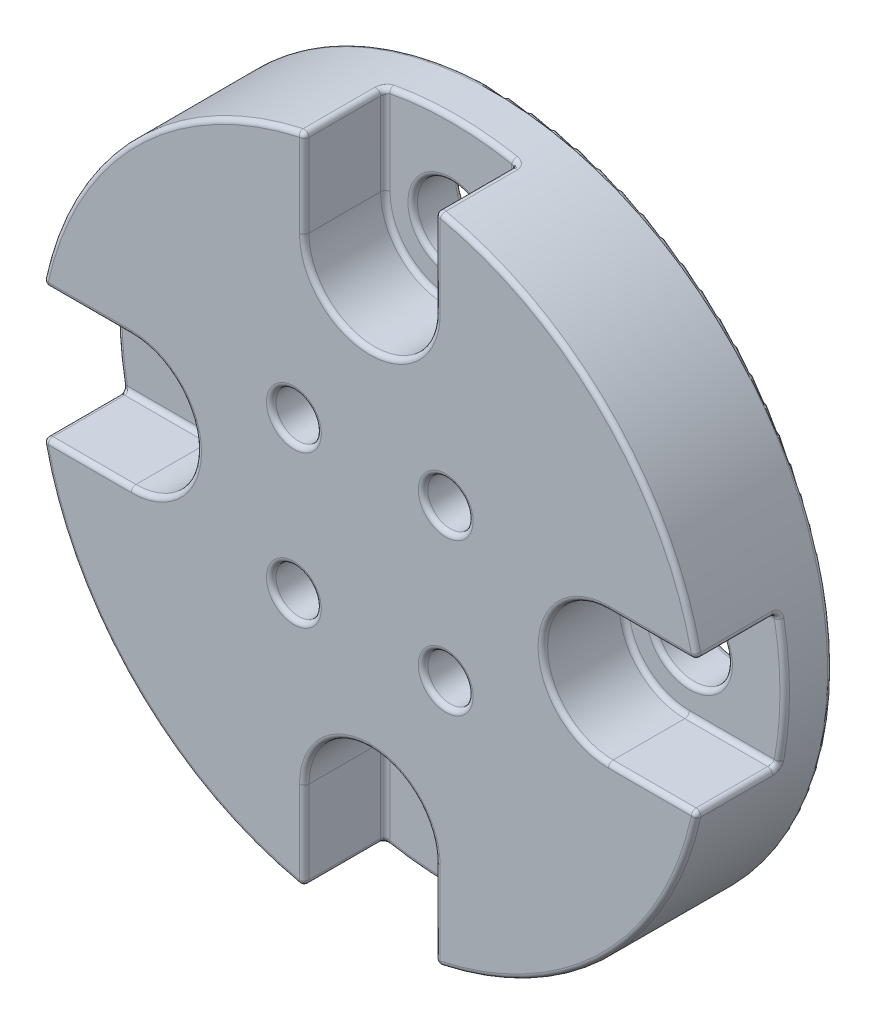
from build123d import *
from build123d.topology import SkipClean

# Parameters (mm, degrees)
SKETCH_1_R          = 15
SKETCH_1_R_2        = 11.5
EXTRUDE_1_DEPTH     = 1.8
EXTRUDE_START       = 2
SKETCH_1_3_R        = 15
EXTRUDE_2_DEPTH     = 2
SKETCH_2_R          = 1.6
CUT_EXTRUDE_1_DEPTH = 2
EXTRUDE_START_2     = 3.4
EXTRUDE_3_DEPTH     = 3.4
SKETCH_4_R          = 0.95
CUT_EXTRUDE_2_DEPTH = 23.401785643
SKETCH_5_R          = 30.103077633
SKETCH_5_R_2        = 14
CUT_EXTRUDE_3_DEPTH = 23.401785643
SKETCH_6_R          = 28.430595143
CUT_EXTRUDE_4_DEPTH = 10
FILLET_1_R          = 0.2


with BuildPart() as part:
    # 스케치1 → 보스-돌출1 (new body)
    with BuildSketch(Plane.XY):
        Circle(SKETCH_1_R)
        Circle(SKETCH_1_R_2, mode=Mode.SUBTRACT)
    extrude(amount=-EXTRUDE_1_DEPTH)

    # 스케치1<3> → 보스-돌출2 (add)
    with BuildSketch(Plane.XY.offset(EXTRUDE_START)):
        Circle(SKETCH_1_3_R)
    extrude(amount=-EXTRUDE_2_DEPTH)

    # 스케치2 → 컷-돌출1 (cut)
    with BuildSketch(Plane.XY.offset(2)):
        with Locations((0, 10.005)):
            Circle(SKETCH_2_R)
        with Locations((10.005, 0)):
            Circle(SKETCH_2_R)
        with Locations((0, -10.005)):
            Circle(SKETCH_2_R)
        with Locations((-10.005, 0)):
            Circle(SKETCH_2_R)
    extrude(amount=-CUT_EXTRUDE_1_DEPTH, mode=Mode.SUBTRACT)

    # 스케치3 → 보스-돌출3 (add)
    with SkipClean():  # the faces are left unmerged after this step: merging them gives an invalid solid
        with BuildSketch(Plane.XY.offset(2).offset(EXTRUDE_START_2)):
            with BuildLine():
                Line((-10.005, 2.75), (-14.745762103, 2.75))
                ThreePointArc((-14.745762103, 2.75), (-10.606601718, 10.606601718), (-2.75, 14.745762103))
                Line((-2.75, 14.745762103), (-2.75, 10.005))
                ThreePointArc((-2.75, 10.005), (0, 7.255), (2.75, 10.005))
                Line((2.75, 10.005), (2.75, 14.745762103))
                ThreePointArc((2.75, 14.745762103), (10.606601718, 10.606601718), (14.745762103, 2.75))
                Line((14.745762103, 2.75), (10.005, 2.75))
                ThreePointArc((10.005, 2.75), (7.255, 0), (10.005, -2.75))
                Line((10.005, -2.75), (14.745762103, -2.75))
                ThreePointArc((14.745762103, -2.75), (10.606601718, -10.606601718), (2.75, -14.745762103))
                Line((2.75, -14.745762103), (2.75, -10.005))
                ThreePointArc((2.75, -10.005), (0, -7.255), (-2.75, -10.005))
                Line((-2.75, -10.005), (-2.75, -14.745762103))
                ThreePointArc((-2.75, -14.745762103), (-10.606601718, -10.606601718), (-14.745762103, -2.75))
                Line((-14.745762103, -2.75), (-10.005, -2.75))
                ThreePointArc((-10.005, -2.75), (-7.255, 0), (-10.005, 2.75))
            make_face()
        extrude(amount=-EXTRUDE_3_DEPTH)

    # 스케치4 → 컷-돌출2 (cut, through all)
    with SkipClean():  # the faces are left unmerged after this step: merging them gives an invalid solid
        with BuildSketch(Plane.XY.offset(5.4)):
            with Locations((3.181980515, 3.181980515)):
                Circle(SKETCH_4_R)
            with Locations((3.181980515, -3.181980515)):
                Circle(SKETCH_4_R)
            with Locations((-3.181980515, -3.181980515)):
                Circle(SKETCH_4_R)
            with Locations((-3.181980515, 3.181980515)):
                Circle(SKETCH_4_R)
        extrude(amount=-CUT_EXTRUDE_2_DEPTH, mode=Mode.SUBTRACT)

    # 스케치5 → 컷-돌출3 (cut, through all)
    with BuildSketch(Plane.XY.offset(5.4)):
        Circle(SKETCH_5_R)
        Circle(SKETCH_5_R_2, mode=Mode.SUBTRACT)
    extrude(amount=-CUT_EXTRUDE_3_DEPTH, mode=Mode.SUBTRACT)

    # 스케치6 → 컷-돌출4 (cut)
    with BuildSketch(Plane(origin=(0, 0, 0), x_dir=(-1, 0, 0), z_dir=(0, 0, -1))):
        Circle(SKETCH_6_R)
    extrude(amount=CUT_EXTRUDE_4_DEPTH, mode=Mode.SUBTRACT)

    # 필렛1
    fillet_1_edges = [part.edges().sort_by_distance(p)[0] for p in [
        (-2.75, 13.727253913, 3.7),
        (2.75, 13.727253913, 3.7),
        (-13.727253913, -2.75, 3.7),
        (-13.727253913, 2.75, 3.7),
        (2.75, -13.727253913, 3.7),
        (-2.75, -13.727253913, 3.7),
        (13.727253913, 2.75, 3.7),
        (13.727253913, -2.75, 3.7),
        (0, 7.255, 2),
        (-2.75, 11.866126957, 2),
        (0, 14, 2),
        (2.75, 11.866126957, 2),
        (-1.6, 10.005, 2),
        (-7.255, 0, 2),
        (-11.866126957, -2.75, 2),
        (-14, 0, 2),
        (-11.866126957, 2.75, 2),
        (-11.605, 0, 2),
        (0, -7.255, 2),
        (2.75, -11.866126957, 2),
        (0, -14, 2),
        (-2.75, -11.866126957, 2),
        (-1.6, -10.005, 2),
        (7.255, 0, 2),
        (11.866126957, 2.75, 2),
        (13.931646615, 1.381746217, 2),
        (11.866126957, -2.75, 2),
        (8.405, 0, 2),
        (-14, 0, 0),
        (-11.605, 0, 0),
        (2.231980515, 3.181980515, 0),
        (2.231980515, -3.181980515, 0),
        (-4.131980515, -3.181980515, 0),
        (-4.131980515, 3.181980515, 0),
        (-1.6, 10.005, 0),
        (8.405, 0, 0),
        (-1.6, -10.005, 0),
        (7.255, 0, 5.4),
        (11.866126957, -2.75, 5.4),
        (9.899494937, -9.899494937, 5.4),
        (2.75, -11.866126957, 5.4),
        (0, -7.255, 5.4),
        (-2.75, -11.866126957, 5.4),
        (-9.899494937, -9.899494937, 5.4),
        (-11.866126957, -2.75, 5.4),
        (-7.255, 0, 5.4),
        (-11.866126957, 2.75, 5.4),
        (-9.899494937, 9.899494937, 5.4),
        (-2.75, 11.866126957, 5.4),
        (0, 7.255, 5.4),
        (2.75, 11.866126957, 5.4),
        (9.899494937, 9.899494937, 5.4),
        (11.866126957, 2.75, 5.4),
        (2.231980515, 3.181980515, 5.4),
        (2.231980515, -3.181980515, 5.4),
        (-4.131980515, -3.181980515, 5.4),
        (-4.131980515, 3.181980515, 5.4),
    ]]
    fillet(fillet_1_edges, radius=FILLET_1_R)


solid = part.part
